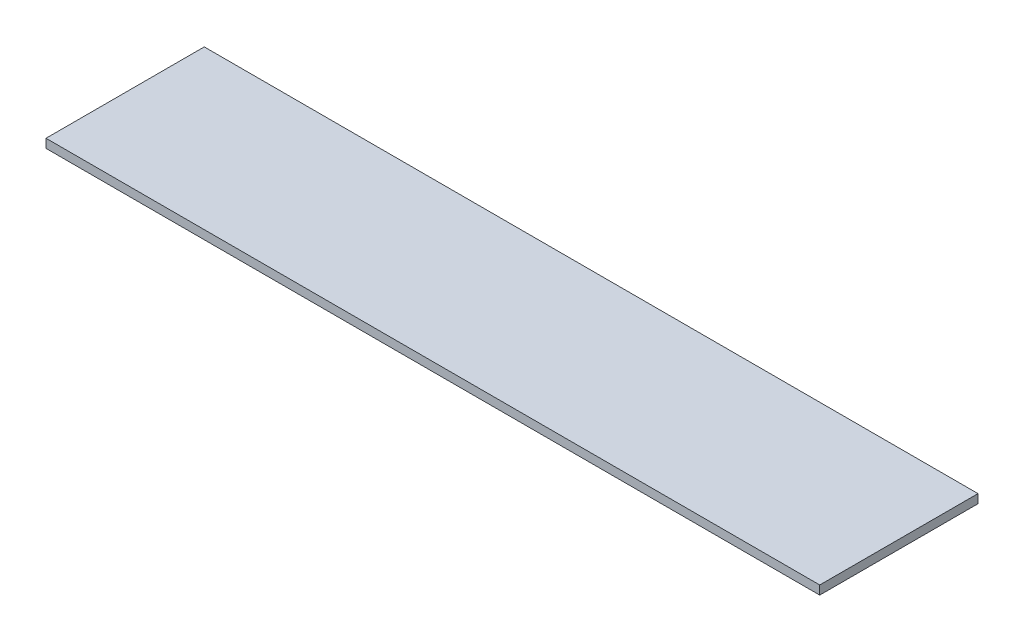
from build123d import *

# Parameters (mm, degrees)
SKETCH1_W           = 88
SKETCH1_H           = 18
BOSS_EXTRUDE1_DEPTH = 1


with BuildPart() as part:
    # Sketch1 → Boss-Extrude1 (new body)
    with BuildSketch(Plane(origin=(0, 0, 0), x_dir=(1, 0, 0), z_dir=(0, 1, 0))):
        with Locations((44.016421842, 7.300007491)):
            Rectangle(SKETCH1_W, SKETCH1_H)
    extrude(amount=BOSS_EXTRUDE1_DEPTH)


solid = part.part
